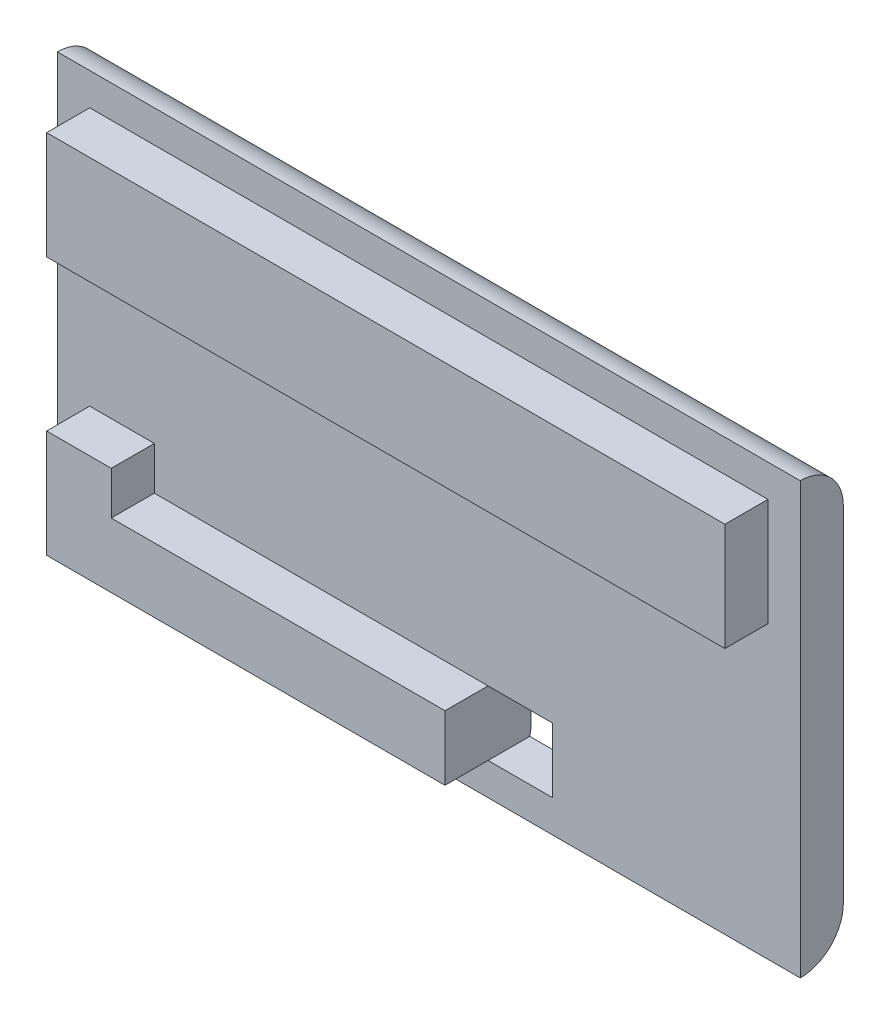
from build123d import *

# Parameters (mm, degrees)
SKETCH1_W           = 34.5
SKETCH1_H           = 20
BOSS_EXTRUDE1_DEPTH = 2
SKETCH2_W           = 31.5
SKETCH2_H           = 5
BOSS_EXTRUDE2_DEPTH = 2
SKETCH3_W           = 3
SKETCH3_H           = 3
CUT_EXTRUDE1_DEPTH  = 10
FILLET1_R           = 2
CUT_EXTRUDE2_DEPTH  = 2


with BuildPart() as part:
    # Sketch1 → Boss-Extrude1 (new body)
    with BuildSketch(Plane.XY):
        Rectangle(SKETCH1_W, SKETCH1_H)
    extrude(amount=BOSS_EXTRUDE1_DEPTH)

    # Sketch2 → Boss-Extrude2 (add)
    with BuildSketch(Plane.XY.offset(2)):
        with Locations((0, 6)):
            Rectangle(SKETCH2_W, SKETCH2_H)
        with Locations((0, -6)):
            Rectangle(SKETCH2_W, SKETCH2_H)
    extrude(amount=BOSS_EXTRUDE2_DEPTH)

    # Sketch3 → Cut-Extrude1 (cut)
    with BuildSketch(Plane(origin=(0, 0, 0), x_dir=(-1, 0, 0), z_dir=(0, 0, -1))):
        with Locations((-4.25, -7)):
            Rectangle(SKETCH3_W, SKETCH3_H)
    extrude(amount=-CUT_EXTRUDE1_DEPTH, mode=Mode.SUBTRACT)

    # Fillet1
    # the kernel refuses this fillet: 2 mm, written as the material it takes off along each edge
    with BuildSketch(Plane(origin=(22.25, -10, 0), x_dir=(0, 1, 0), z_dir=(-1, 0, 0))) as fillet1_piece_1:
        with BuildLine():
            CenterArc((FILLET1_R, -FILLET1_R), FILLET1_R, 90, 90)
            Line((0, -FILLET1_R), (0, 0))
            Line((0, 0), (FILLET1_R, 0))
        make_face()
    extrude(amount=44.5, mode=Mode.SUBTRACT)
    with BuildSketch(Plane(origin=(-22.25, 10, 0), x_dir=(0, 0, 1), z_dir=(1, 0, 0))) as fillet1_piece_2:
        with BuildLine():
            CenterArc((FILLET1_R, FILLET1_R), FILLET1_R, 180, 90)
            Line((0, FILLET1_R), (0, 0))
            Line((0, 0), (FILLET1_R, 0))
        make_face()
    extrude(amount=44.5, mode=Mode.SUBTRACT)

    # Sketch4 → Cut-Extrude2 (cut)
    with BuildSketch(Plane.XY.offset(4)):
        Polygon((15.75, -8.5), (5.75, -8.5), (5.75, -5.5), (-12.75, -5.5), (-12.75, -3.5), (5.75, -3.5), (15.75, -3.5), align=None)
    extrude(amount=-CUT_EXTRUDE2_DEPTH, mode=Mode.SUBTRACT)


solid = part.part
